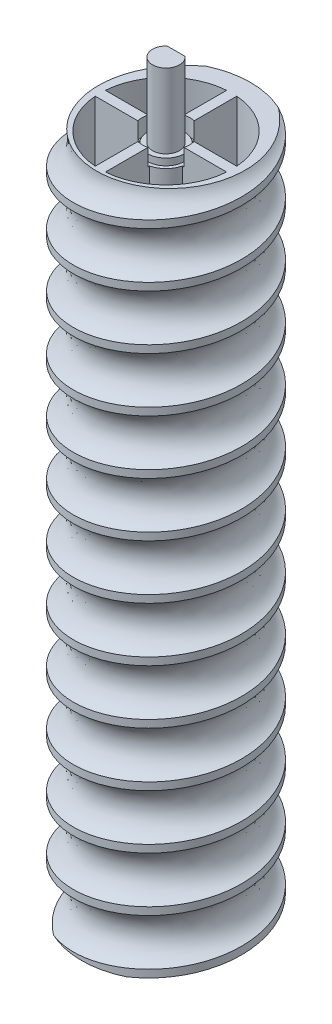
from build123d import *

# Parameters (mm, degrees)
SKETCH1_R                = 25
BOSS_EXTRUDE1_DEPTH      = 200
CUT_SWEEP1_PITCH         = 16
SKETCH5_R                = 5
CUT_EXTRUDE1_DEPTH       = 204.97633621
SKETCH6_R                = 4
BOSS_EXTRUDE2_DEPTH      = 29
CUT_EXTRUDE2_DEPTH       = 14
BOSS_EXTRUDE6_DEPTH      = 1
BOSS_EXTRUDE6_DEPTH_BACK = 5
SKETCH15_R               = 5
SKETCH15_R_2             = 1.95
SKETCH16_R               = 7
SKETCH16_R_2             = 5
CUT_EXTRUDE4_DEPTH       = 5
SKETCH17_R               = 5.5
BOSS_EXTRUDE7_DEPTH      = 2
SKETCH19_R               = 3
CUT_EXTRUDE5_DEPTH       = 50
CUT_EXTRUDE6_START       = -2
SKETCH20_R               = 5
SKETCH20_R_2             = 1.95
CUT_EXTRUDE6_DEPTH       = 2
BOSS_EXTRUDE8_START      = -7
SKETCH21_R               = 5.5
BOSS_EXTRUDE8_DEPTH      = 7


with BuildPart() as part:
    # Sketch1 → Boss-Extrude1 (new body)
    with BuildSketch(Plane(origin=(0, 0, 0), x_dir=(1, 0, 0), z_dir=(0, 1, 0))):
        with Locations(Location((0, 0, 0), (0, 0, 270))):
            Circle(SKETCH1_R)
    extrude(amount=BOSS_EXTRUDE1_DEPTH)

    # Cut-Sweep1: arcs per turn and ends read off the stored shape
    # Cut-Sweep1: the profile of Sketch4 screwed along a right-hand helix through 16 turns, 18 arcs to a turn; built about Z, then put on its axis
    cut_sweep1_z = Axis((0, 0, 0), (0, 0, 1))
    cut_sweep1_corners = [(20.5, 0, -16), (28, 0, -23.5), (35.5, 0, -16), (28, 0, -8.5)]
    with BuildLine(mode=Mode.PRIVATE) as cut_sweep1_profile:
        ThreePointArc((20.5, 0, -16), (22.696699141, 0, -21.303300859), (28, 0, -23.5))
        ThreePointArc((28, 0, -23.5), (33.303300859, 0, -21.303300859), (35.5, 0, -16))
        ThreePointArc((35.5, 0, -16), (33.303300859, 0, -10.696699141), (28, 0, -8.5))
        ThreePointArc((28, 0, -8.5), (22.696699141, 0, -10.696699141), (20.5, 0, -16))
    cut_sweep1_cap = Face(cut_sweep1_profile.wire())
    cut_sweep1_arcs = [((20.5, 0, -16), (20.5, 0, -23.5), (28, 0, -23.5), (1, 0.7071067811865476, 1)), ((28, 0, -23.5), (35.5, 0, -23.5), (35.5, 0, -16), (1, 0.7071067811865476, 1)), ((35.5, 0, -16), (35.5, 0, -8.5), (28, 0, -8.5), (1, 0.7071067811865476, 1)), ((28, 0, -8.5), (20.5, 0, -8.5), (20.5, 0, -16), (1, 0.7071067811865476, 1))]  # start, shoulder, end, weights
    cut_sweep1_turn_angles = [0, 10, 20, 30, 40, 50, 60, 70, 80, 90, 100, 110, 120, 130, 140, 150, 160, 170, 180, 190, 200, 210, 220, 230, 240, 250, 260, 270, 280, 290, 300, 310, 320, 330, 340, 350, 360]
    cut_sweep1_turn_weights = [1, 0.984807753012208, 1, 0.984807753012208, 1, 0.984807753012208, 1, 0.984807753012208, 1, 0.984807753012208, 1, 0.984807753012208, 1, 0.984807753012208, 1, 0.984807753012208, 1, 0.984807753012208, 1, 0.984807753012208, 1, 0.984807753012208, 1, 0.984807753012208, 1, 0.984807753012208, 1, 0.984807753012208, 1, 0.984807753012208, 1, 0.984807753012208, 1, 0.984807753012208, 1, 0.984807753012208, 1]
    cut_sweep1_turn_sides = [Face.make_bezier_surface([[Vector(p[j][0], p[j][1], 0).rotate(cut_sweep1_z, cut_sweep1_turn_angles[2 * i + k]) / cut_sweep1_turn_weights[2 * i + k] + Vector(0, 0, p[j][2] + CUT_SWEEP1_PITCH * cut_sweep1_turn_angles[2 * i + k] / 360) for k in range(3)] for j in range(3)], [[p[3][j] * cut_sweep1_turn_weights[2 * i + k] for k in range(3)] for j in range(3)]) for p in cut_sweep1_arcs for i in range(18)]
    cut_sweep1 = Plane(origin=(0, 200, 0), x_dir=(0, 0, 1), z_dir=(0, -1, 0)) * Solid(Shell([*[p.moved(Location((0, 0, CUT_SWEEP1_PITCH * i))) for i in range(16) for p in cut_sweep1_turn_sides], cut_sweep1_cap, cut_sweep1_cap.rotate(cut_sweep1_z, 5760).moved(Location((0, 0, CUT_SWEEP1_PITCH * 5760 / 360)))]))
    add(cut_sweep1, mode=Mode.SUBTRACT)

    # Sketch5 → Cut-Extrude1 (cut, through all)
    with BuildSketch(Plane(origin=(0, 200, 0), x_dir=(1, 0, 0), z_dir=(0, 1, 0))):
        with Locations(Location((0, 0, 0), (0, 0, 270))):
            Circle(SKETCH5_R)
        with BuildLine():
            Line((-1.5, 19.442222095), (-1.5, 6.32455532))
            ThreePointArc((-1.5, 6.32455532), (-4.596194078, 4.596194078), (-6.32455532, 1.5))
            Line((-6.32455532, 1.5), (-19.442222095, 1.5))
            ThreePointArc((-19.442222095, 1.5), (-13.788582233, 13.788582233), (-1.5, 19.442222095))
        make_face()
        with BuildLine():
            Line((1.5, 19.442222095), (1.5, 6.32455532))
            ThreePointArc((1.5, 6.32455532), (4.596194078, 4.596194078), (6.32455532, 1.5))
            Line((6.32455532, 1.5), (19.442222095, 1.5))
            ThreePointArc((19.442222095, 1.5), (13.788582233, 13.788582233), (1.5, 19.442222095))
        make_face()
        with BuildLine():
            Line((19.442222095, -1.5), (6.32455532, -1.5))
            ThreePointArc((6.32455532, -1.5), (4.596194078, -4.596194078), (1.5, -6.32455532))
            Line((1.5, -6.32455532), (1.5, -19.442222095))
            ThreePointArc((1.5, -19.442222095), (13.788582233, -13.788582233), (19.442222095, -1.5))
        make_face()
        with BuildLine():
            Line((-1.5, -19.442222095), (-1.5, -6.32455532))
            ThreePointArc((-1.5, -6.32455532), (-4.596194078, -4.596194078), (-6.32455532, -1.5))
            Line((-6.32455532, -1.5), (-19.442222095, -1.5))
            ThreePointArc((-19.442222095, -1.5), (-13.788582233, -13.788582233), (-1.5, -19.442222095))
        make_face()
    extrude(amount=-CUT_EXTRUDE1_DEPTH, mode=Mode.SUBTRACT)

    # Sketch15 → Boss-Extrude6 (add, two sides: drawn at the far end of the back side and taken through both)
    with BuildSketch(Plane.XZ.offset(-BOSS_EXTRUDE6_DEPTH_BACK)):
        with Locations(Location((0, 0, 0), (0, 0, 90))):
            Circle(SKETCH15_R)
        with Locations(Location((0, 0, 0), (0, 0, 270))):
            Circle(SKETCH15_R_2, mode=Mode.SUBTRACT)
    extrude(amount=BOSS_EXTRUDE6_DEPTH + BOSS_EXTRUDE6_DEPTH_BACK)

    # Sketch16 → Cut-Extrude4 (cut)
    with BuildSketch(Plane(origin=(0, 200, 0), x_dir=(1, 0, 0), z_dir=(0, 1, 0))):
        Circle(SKETCH16_R)
        with Locations(Location((0, 0, 0), (0, 0, 270))):
            Circle(SKETCH16_R_2, mode=Mode.SUBTRACT)
    extrude(amount=-CUT_EXTRUDE4_DEPTH, mode=Mode.SUBTRACT)

    # Sketch17 → Boss-Extrude7 (add)
    with BuildSketch(Plane(origin=(0, 195, 0), x_dir=(1, 0, 0), z_dir=(0, 1, 0))):
        with Locations(Location((0, 0, 0), (0, 0, 270))):
            Circle(SKETCH17_R)
    extrude(amount=BOSS_EXTRUDE7_DEPTH)

    # Sketch19 → Cut-Extrude5 (cut)
    with BuildSketch(Plane(origin=(0, 219, 0), x_dir=(1, 0, 0), z_dir=(0, 1, 0))):
        with Locations(Location((0, 0, 0), (0, 0, 270))):
            Circle(SKETCH19_R)
    extrude(amount=-CUT_EXTRUDE5_DEPTH, mode=Mode.SUBTRACT)

    # Sketch20 → Cut-Extrude6 (cut)
    with BuildSketch(Plane.XZ.offset(1).offset(CUT_EXTRUDE6_START)):
        with Locations(Location((0, 0, 0), (0, 0, 90))):
            Circle(SKETCH20_R)
        with Locations(Location((0, 0, 0), (0, 0, 270))):
            Circle(SKETCH20_R_2, mode=Mode.SUBTRACT)
    extrude(amount=CUT_EXTRUDE6_DEPTH, mode=Mode.SUBTRACT)



with BuildPart() as body_2:
    # Sketch6 → Boss-Extrude2 (new body)
    with BuildSketch(Plane(origin=(0, 190, 0), x_dir=(1, 0, 0), z_dir=(0, 1, 0))):
        with Locations(Location((0, 0, 0), (0, 0, 90))):
            Circle(SKETCH6_R)
    extrude(amount=BOSS_EXTRUDE2_DEPTH)

    # Sketch7 → Cut-Extrude2 (cut)
    with BuildSketch(Plane(origin=(0, 219, 0), x_dir=(1, 0, 0), z_dir=(0, 1, 0))):
        with BuildLine():
            Line((-2.645751311, 3), (2.645751311, 3))
            ThreePointArc((2.645751311, 3), (0, 4), (-2.645751311, 3))
        make_face()
    extrude(amount=-CUT_EXTRUDE2_DEPTH, mode=Mode.SUBTRACT)


with BuildPart() as part_1:
    add(part.part)

    add(body_2.part)  # Boss-Extrude8 merges body 2
    # Sketch21 → Boss-Extrude8 (add)
    with BuildSketch(Plane(origin=(0, 197, 0), x_dir=(1, 0, 0), z_dir=(0, 1, 0)).offset(BOSS_EXTRUDE8_START)):
        with Locations(Location((0, 0, 0), (0, 0, 270))):
            Circle(SKETCH21_R)
    extrude(amount=BOSS_EXTRUDE8_DEPTH)


solid = part_1.part
